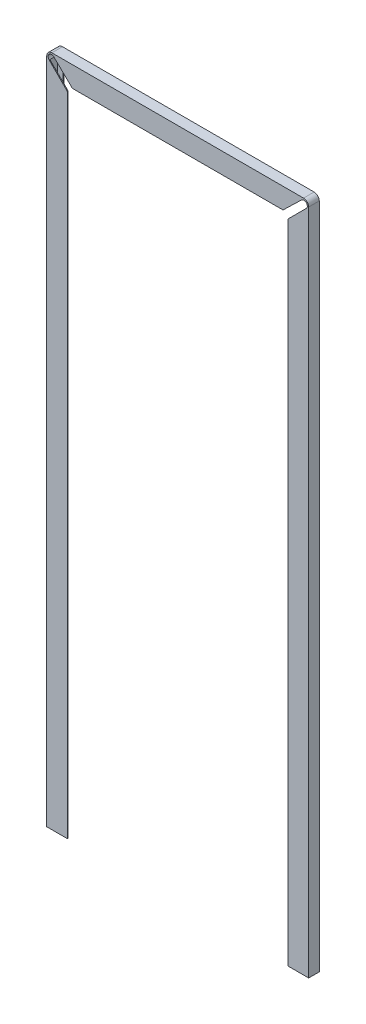
from build123d import *

# Parameters (mm, degrees)
SKETCH1_W           = 647.7
SKETCH1_H           = 1663.7
BOSS_EXTRUDE1_DEPTH = 26.162
SKETCH2_W           = 546.1
SKETCH2_H           = 1612.9
CUT_EXTRUDE1_DEPTH  = 26.162
CUT_EXTRUDE2_DEPTH  = 26.162
CUT_EXTRUDE3_DEPTH  = 24.13
FILLET1_R           = 12.7
SHELL4_START        = 1.778
SHELL4_DEPTH        = 22.606


# Read off the part's stored shape, not the designer's step: Shell4
with BuildPart() as part:
    # Sketch1 → Boss-Extrude1 (new body)
    with BuildSketch(Plane.XY):
        Rectangle(SKETCH1_W, SKETCH1_H)
    extrude(amount=BOSS_EXTRUDE1_DEPTH)

    # Sketch2 → Cut-Extrude1 (cut)
    with BuildSketch(Plane.XY.offset(26.162)):
        with Locations((0, -25.4)):
            Rectangle(SKETCH2_W, SKETCH2_H)
    extrude(amount=-CUT_EXTRUDE1_DEPTH, mode=Mode.SUBTRACT)

    # Sketch3 → Cut-Extrude2 (cut)
    with BuildSketch(Plane.XY.offset(26.162)):
        with BuildLine():
            Line((-317.951280605, 813.251280605), (-273.05, 768.35))
            Line((-273.05, 768.35), (-273.05, 781.05))
            Line((-273.05, 781.05), (-260.35, 781.05))
            Line((-260.35, 781.05), (-305.950453026, 825.241047594))
            ThreePointArc((-305.950453026, 825.241047594), (-317.94851482, 825.249344949), (-317.951280605, 813.251280605))
        make_face()
        with BuildLine():
            Line((305.950453026, 825.241047594), (260.35, 781.05))
            Line((260.35, 781.05), (273.05, 781.05))
            Line((273.05, 781.05), (273.05, 768.35))
            Line((273.05, 768.35), (317.951280605, 813.251280605))
            ThreePointArc((317.951280605, 813.251280605), (317.94851482, 825.249344949), (305.950453026, 825.241047594))
        make_face()
    extrude(amount=-CUT_EXTRUDE2_DEPTH, mode=Mode.SUBTRACT)

    # Sketch4 → Cut-Extrude3 (cut)
    with BuildSketch(Plane(origin=(0, 0, 0), x_dir=(-1, 0, 0), z_dir=(0, 0, -1))):
        Polygon((-307.8988, 768.35), (-307.8988, 803.1988), (-273.05, 768.35), (-273.05, -831.85), (-307.8988, -831.85), align=None)
        Polygon((-260.35, 781.05), (-295.735951532, 815.342252918), (295.735951532, 815.342252918), (260.35, 781.05), align=None)
        Polygon((307.8988, 803.1988), (273.05, 768.35), (273.05, -831.85), (307.8988, -831.85), (307.8988, 768.35), align=None)
    extrude(amount=-CUT_EXTRUDE3_DEPTH, mode=Mode.SUBTRACT)

    # Fillet1
    fillet1_edges = [part.edges().sort_by_distance(p)[0] for p in [
        (-323.85, 831.85, 13.081),
        (323.85, 831.85, 13.081),
    ]]
    fillet(fillet1_edges, radius=FILLET1_R)

    # Shell4 outline → Shell4 (cut)
    with BuildSketch(Plane.XY.offset(SHELL4_START)):
        with BuildLine():
            Line((307.8988, 803.1988), (307.8988, -830.072))
            Line((307.8988, -830.072), (322.072, -830.072))
            Line((322.072, -830.072), (322.072, 817.550302353))
            ThreePointArc((322.072, 817.550302353), (321.07369087, 814.548798877), (319.208516462, 811.994044748))
            Line((319.208516462, 811.994044748), (317.951280605, 813.251280605))
            Line((317.951280605, 813.251280605), (307.8988, 803.1988))
        make_face()
        with BuildLine():
            Line((-322.072, -830.072), (-307.8988, -830.072))
            Line((-307.8988, -830.072), (-307.8988, 803.1988))
            Line((-307.8988, 803.1988), (-317.951280605, 813.251280605))
            Line((-317.951280605, 813.251280605), (-319.208516462, 811.994044748))
            ThreePointArc((-319.208516462, 811.994044748), (-321.07369087, 814.548798877), (-322.072, 817.550302353))
            Line((-322.072, 817.550302353), (-322.072, -830.072))
        make_face()
        with BuildLine():
            ThreePointArc((301.905011396, 821.320641288), (309.142763578, 829.116339567), (319.402097182, 826.304926702))
            ThreePointArc((319.402097182, 826.304926702), (315.685635268, 829.085698099), (311.15, 830.072))
            Line((311.15, 830.072), (-311.15, 830.072))
            ThreePointArc((-311.15, 830.072), (-315.685635267, 829.085698099), (-319.402097181, 826.304926702))
            ThreePointArc((-319.402097181, 826.304926702), (-309.142763577, 829.116339567), (-301.905011396, 821.320641288))
            Line((-301.905011396, 821.320641288), (-295.735951532, 815.342252918))
            Line((-295.735951532, 815.342252918), (295.735951532, 815.342252918))
            Line((295.735951532, 815.342252918), (301.905011396, 821.320641288))
        make_face()
    extrude(amount=SHELL4_DEPTH, mode=Mode.SUBTRACT)


solid = part.part
